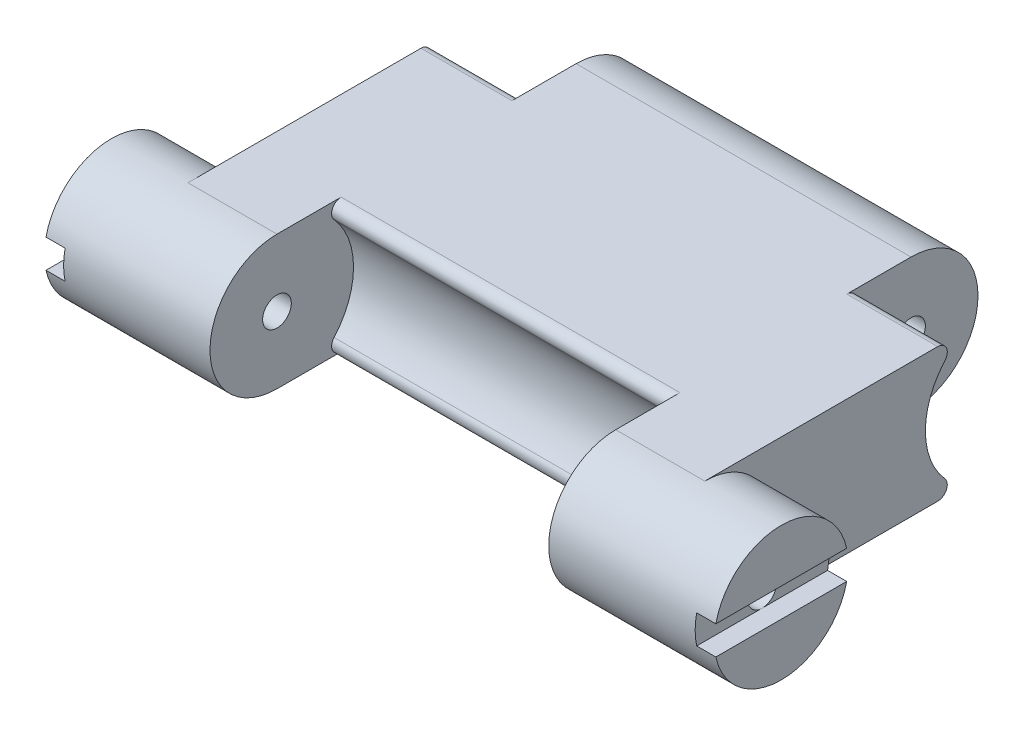
from build123d import *

# Parameters (mm, degrees)
EXTRUDE_1_DEPTH     = 17.5
SKETCH_3_W          = 24
SKETCH_3_H          = 9
SKETCH_3_R          = 3.5
CUT_EXTRUDE_1_DEPTH = 4
SKETCH_6_R          = 4
CUT_EXTRUDE_2_DEPTH = 8.85
SKETCH_7_R          = 4
CUT_EXTRUDE_3_DEPTH = 4.75
SKETCH_9_W          = 7.2
SKETCH_9_H          = 1.5
CUT_EXTRUDE_5_DEPTH = 1
FILLET_1_R          = 0.5
SKETCH_8_R          = 0.75
CUT_EXTRUDE_4_DEPTH = 38.428601697


with BuildPart() as part:
    # Эскиз1 → Бобышка-Вытянуть1 (new, symmetric)
    with BuildSketch(Plane(origin=(0, 0, 0), x_dir=(0, 0, -1), z_dir=(1, 0, 0))):
        with BuildLine():
            Line((-7.765, 7), (7.765, 7))
            ThreePointArc((7.765, 7), (11.265, 3.5), (7.765, 0))
            Line((7.765, 0), (-7.765, 0))
            ThreePointArc((-7.765, 0), (-11.265, 3.5), (-7.765, 7))
        make_face()
    extrude(amount=EXTRUDE_1_DEPTH, both=True)

    # Эскиз3 → Вырез-Вытянуть1 (cut)
    with BuildSketch(Plane(origin=(17.5, 0, 0), x_dir=(0, 0, -1), z_dir=(1, 0, 0))):
        with Locations((0, 3.5)):
            Rectangle(SKETCH_3_W, SKETCH_3_H)
        with Locations((-7.765, 3.5)):
            Circle(SKETCH_3_R, mode=Mode.SUBTRACT)
    cut_extrude_1 = extrude(amount=-CUT_EXTRUDE_1_DEPTH, mode=Mode.SUBTRACT)

    # Зеркальное отражение1: Вырез-Вытянуть1 across plane
    add(cut_extrude_1.mirror(Plane(origin=(0, 0, 0), x_dir=(0, 0, 1), z_dir=(1, 0, 0))), mode=Mode.SUBTRACT)

    # Эскиз6 → Вырез-Вытянуть2 (cut, symmetric)
    with BuildSketch(Plane(origin=(0, 0, 0), x_dir=(0, 0, -1), z_dir=(1, 0, 0))):
        with Locations((-7.765, 3.5)):
            Circle(SKETCH_6_R)
    extrude(amount=CUT_EXTRUDE_2_DEPTH, both=True, mode=Mode.SUBTRACT)

    # Эскиз7 → Вырез-Вытянуть3 (cut)
    with BuildSketch(Plane(origin=(13.5, 0, 0), x_dir=(0, 0, -1), z_dir=(1, 0, 0))):
        with Locations((7.765, 3.5)):
            Circle(SKETCH_7_R)
    cut_extrude_3 = extrude(amount=-CUT_EXTRUDE_3_DEPTH, mode=Mode.SUBTRACT)

    # Эскиз9 → Вырез-Вытянуть5 (cut)
    with BuildSketch(Plane(origin=(17.5, 0, 0), x_dir=(0, 0, -1), z_dir=(1, 0, 0))):
        with Locations((-7.765, 3.5)):
            Rectangle(SKETCH_9_W, SKETCH_9_H)
    cut_extrude_5 = extrude(amount=-CUT_EXTRUDE_5_DEPTH, mode=Mode.SUBTRACT)

    # Зеркальное отражение2: Вырез-Вытянуть3, Вырез-Вытянуть5 across plane
    add(cut_extrude_3.mirror(Plane(origin=(0, 0, 0), x_dir=(0, 0, 1), z_dir=(1, 0, 0))), mode=Mode.SUBTRACT)
    add(cut_extrude_5.mirror(Plane(origin=(0, 0, 0), x_dir=(0, 0, 1), z_dir=(1, 0, 0))), mode=Mode.SUBTRACT)

    # Скругление1
    fillet_1_edges = [part.edges().sort_by_distance(p)[0] for p in [
        (-11.125, 0, -5.828508327),
        (-11.125, 7, -5.828508327),
        (0, 7, 5.828508327),
        (0, 0, 5.828508327),
        (11.125, 7, -5.828508327),
        (11.125, 0, -5.828508327),
    ]]
    fillet(fillet_1_edges, radius=FILLET_1_R)

    # Эскиз8 → Вырез-Вытянуть4 (cut, through all)
    with BuildSketch(Plane(origin=(17.5, 0, 0), x_dir=(0, 0, -1), z_dir=(1, 0, 0))):
        with Locations((-7.765, 3.5)):
            Circle(SKETCH_8_R)
        with Locations((7.765, 3.5)):
            Circle(SKETCH_8_R)
    extrude(amount=-CUT_EXTRUDE_4_DEPTH, mode=Mode.SUBTRACT)


solid = part.part
